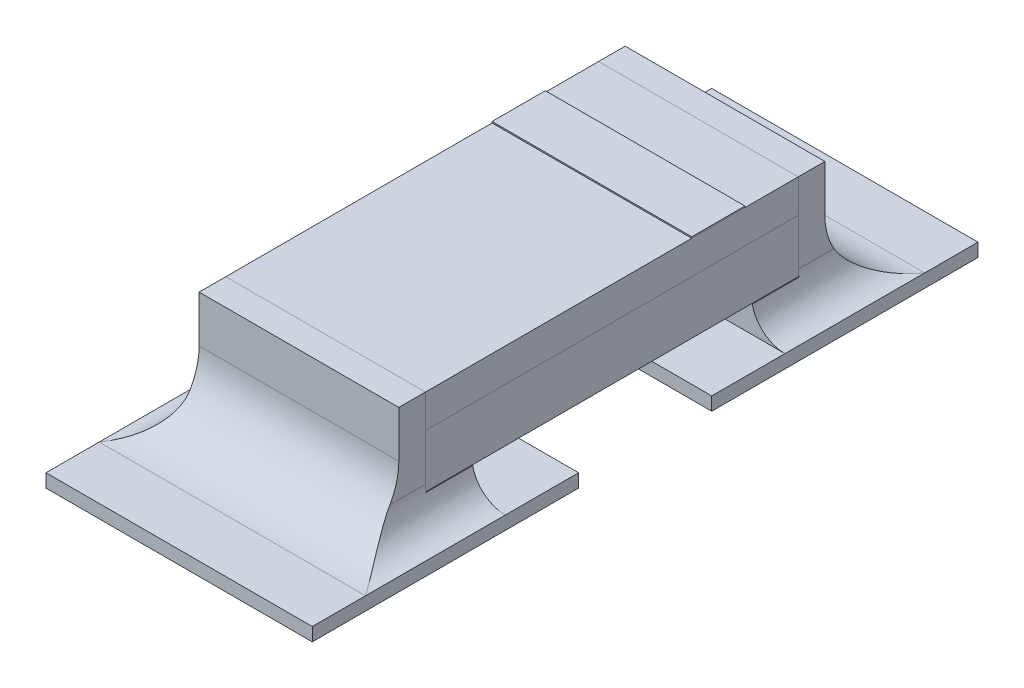
from build123d import *

# Parameters (mm, degrees)
SKETCH1_W             = 1.5
SKETCH1_H             = 0.4
BOSS_EXTRUDE1_DEPTH   = 1.4
BOSS_EXTRUDE2_DEPTH   = 0.75
BOSS_EXTRUDE2_2_DEPTH = 0.75
SKETCH5_W             = 1.5
SKETCH5_H             = 0.25
BOSS_EXTRUDE4_DEPTH   = 1.4
SKETCH4_W             = 2
SKETCH4_H             = 2
BOSS_EXTRUDE3_DEPTH   = 0.1
SKETCH6_W             = 1.5
SKETCH6_H             = 0.4
BOSS_EXTRUDE5_DEPTH   = 0.01
FILLET1_R             = 0.5
FILLET2_R             = 0.5
FILLET3_START         = -1.5999999
FILLET3_DEPTH         = 0.5499999
FILLET3_START_2       = -2.1000001
FILLET3_2_DEPTH       = 0.5000001
FILLET3_START_3       = -2
FILLET3_3_OUTLINE_W   = 0.05
FILLET3_3_OUTLINE_H   = 0.35
FILLET3_3_DEPTH       = 4
FILLET4_START         = 1.05
FILLET4_DEPTH         = 0.5499999
FILLET4_START_2       = 1.5999999
FILLET4_2_DEPTH       = 0.5000001
FILLET4_START_3       = -2
FILLET4_3_OUTLINE_W   = 0.05
FILLET4_3_OUTLINE_H   = 0.35
FILLET4_3_DEPTH       = 4


with BuildPart() as part:
    # Sketch1 → Boss-Extrude1 (new, symmetric)
    with BuildSketch(Plane.XY):
        with Locations((0, 0.5)):
            Rectangle(SKETCH1_W, SKETCH1_H)
    extrude(amount=BOSS_EXTRUDE1_DEPTH, both=True)


with BuildPart() as body_2:
    # Sketch3 → Boss-Extrude2 (new, symmetric)
    with BuildSketch(Plane(origin=(0, 0, 0), x_dir=(0, 0, -1), z_dir=(1, 0, 0))):
        Polygon((-1.4, 0.95), (-1.6, 0.95), (-1.6, 0.1), (-1.05, 0.1), (-1.05, 0.3), (-1.4, 0.3), align=None)
    extrude(amount=BOSS_EXTRUDE2_DEPTH, both=True)



with BuildPart() as body_3:
    # Sketch3 → Boss-Extrude2 2 (new, symmetric)
    with BuildSketch(Plane(origin=(0, 0, 0), x_dir=(0, 0, -1), z_dir=(1, 0, 0))):
        Polygon((1.4, 0.95), (1.6, 0.95), (1.6, 0.1), (1.05, 0.1), (1.05, 0.3), (1.4, 0.3), align=None)
    extrude(amount=BOSS_EXTRUDE2_2_DEPTH, both=True)


with BuildPart() as body_4:
    # Sketch5 → Boss-Extrude4 (new, symmetric)
    with BuildSketch(Plane.XY):
        with Locations((0, 0.825)):
            Rectangle(SKETCH5_W, SKETCH5_H)
    extrude(amount=BOSS_EXTRUDE4_DEPTH, both=True)


with BuildPart() as body_2_1:
    add(body_2.part)

    add(body_3.part)  # Boss-Extrude3 merges body 3
    # Sketch4 → Boss-Extrude3 (add)
    with BuildSketch(Plane(origin=(0, 0, 0), x_dir=(1, 0, 0), z_dir=(0, 1, 0))):
        with Locations((0, 1.5)):
            Rectangle(SKETCH4_W, SKETCH4_H)
        with Locations((0, -1.5)):
            Rectangle(SKETCH4_W, SKETCH4_H)
    extrude(amount=BOSS_EXTRUDE3_DEPTH)

    # Fillet1
    fillet1_edges = [body_2_1.edges().sort_by_distance(p)[0] for p in [
        (0, 0.1, 1.6),
    ]]
    fillet(fillet1_edges, radius=FILLET1_R)

    # Fillet2
    fillet2_edges = [body_2_1.edges().sort_by_distance(p)[0] for p in [
        (0, 0.1, -1.6),
    ]]
    fillet(fillet2_edges, radius=FILLET2_R)

    # Fillet3: read off the stored shape, not the designer's step
    # Fillet3 outline → Fillet3 (add)
    with BuildSketch(Plane.XY.offset(FILLET3_START)):
        with BuildLine():
            Line((0.75, 0.1), (1, 0.1))
            ThreePointArc((1, 0.1), (0.823223305, 0.173223305), (0.75, 0.35))
            Line((0.75, 0.35), (0.75, 0.1))
        make_face()
        with BuildLine():
            Line((-1, 0.1), (-0.75, 0.1))
            Line((-0.75, 0.1), (-0.75, 0.35))
            ThreePointArc((-0.75, 0.35), (-0.823223305, 0.173223305), (-1, 0.1))
        make_face()
    extrude(amount=FILLET3_DEPTH)

    # Fillet3 2 outline → Fillet3 2 (add)
    with BuildSketch(Plane.XY.offset(FILLET3_START_2)):
        with BuildLine():
            Line((0.75, 0.1), (1, 0.1))
            ThreePointArc((1, 0.1), (0.823223305, 0.173223305), (0.75, 0.35))
            Line((0.75, 0.35), (0.75, 0.1))
        make_face()
        with BuildLine():
            Line((-1, 0.1), (-0.75, 0.1))
            Line((-0.75, 0.1), (-0.75, 0.35))
            ThreePointArc((-0.75, 0.35), (-0.823223305, 0.173223305), (-1, 0.1))
        make_face()
    extrude(amount=FILLET3_2_DEPTH)

    # Fillet3 3 outline → Fillet3 3 (cut)
    with BuildSketch(Plane.YZ.offset(FILLET3_START_3)):
        with BuildLine():
            Line((0.1, -2.1), (0.35, -2.1000001))
            Line((0.35, -2.1000001), (0.35, -1.666987298))
            ThreePointArc((0.35, -1.666987298), (0.166987298, -1.85), (0.1, -2.1))
        make_face()
        with Locations((0.325, -1.225)):
            Rectangle(FILLET3_3_OUTLINE_W, FILLET3_3_OUTLINE_H)
    extrude(amount=FILLET3_3_DEPTH, mode=Mode.SUBTRACT)

    # Fillet4: read off the stored shape, not the designer's step
    # Fillet4 outline → Fillet4 (add)
    with BuildSketch(Plane.XY.offset(FILLET4_START)):
        with BuildLine():
            Line((-0.75, 0.1), (-0.75, 0.35))
            ThreePointArc((-0.75, 0.35), (-0.823223305, 0.173223305), (-1, 0.1))
            Line((-1, 0.1), (-0.75, 0.1))
        make_face()
        with BuildLine():
            Line((0.75, 0.35), (0.75, 0.1))
            Line((0.75, 0.1), (1, 0.1))
            ThreePointArc((1, 0.1), (0.823223305, 0.173223305), (0.75, 0.35))
        make_face()
    extrude(amount=FILLET4_DEPTH)

    # Fillet4 2 outline → Fillet4 2 (add)
    with BuildSketch(Plane.XY.offset(FILLET4_START_2)):
        with BuildLine():
            Line((-0.75, 0.1), (-0.75, 0.35))
            ThreePointArc((-0.75, 0.35), (-0.823223305, 0.173223305), (-1, 0.1))
            Line((-1, 0.1), (-0.75, 0.1))
        make_face()
        with BuildLine():
            Line((0.75, 0.35), (0.75, 0.1))
            Line((0.75, 0.1), (1, 0.1))
            ThreePointArc((1, 0.1), (0.823223305, 0.173223305), (0.75, 0.35))
        make_face()
    extrude(amount=FILLET4_2_DEPTH)

    # Fillet4 3 outline → Fillet4 3 (cut)
    with BuildSketch(Plane.YZ.offset(FILLET4_START_3)):
        with BuildLine():
            ThreePointArc((0.1, 2.1), (0.166987298, 1.85), (0.35, 1.666987298))
            Line((0.35, 1.666987298), (0.35, 2.1))
            Line((0.35, 2.1), (0.1, 2.1))
        make_face()
        with Locations((0.325, 1.225)):
            Rectangle(FILLET4_3_OUTLINE_W, FILLET4_3_OUTLINE_H)
    extrude(amount=FILLET4_3_DEPTH, mode=Mode.SUBTRACT)


with BuildPart() as body_4_2:
    # Sketch6 → Boss-Extrude5 (new body)
    with BuildSketch(Plane(origin=(0, 0.95, 0), x_dir=(1, 0, 0), z_dir=(0, 1, 0))):
        with Locations((0, 0.8)):
            Rectangle(SKETCH6_W, SKETCH6_H)
    extrude(amount=BOSS_EXTRUDE5_DEPTH)


solid = Compound([part.part, body_4.part, body_2_1.part, body_4_2.part])
